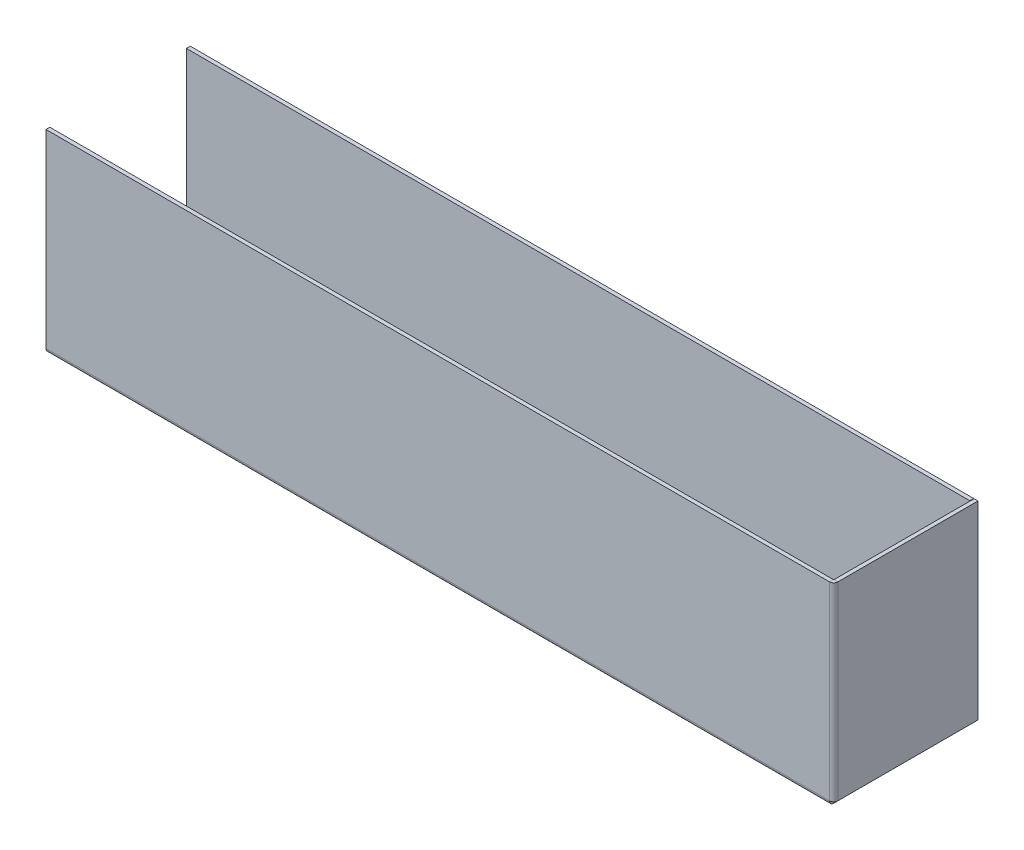
from build123d import *

# Parameters (mm, degrees)
SKETCH2_W             = 202
SKETCH2_H             = 13.5
BASE_FLANGE1_DEPTH    = 1
EDGE_FLANGE1_DEPTH    = 202
SWEPT_FLANGE2_DEPTH   = 202
SWEPT_FLANGE2_2_DEPTH = 202
EDGE_FLANGE2_DEPTH    = 202
EDGE_FLANGE3_DEPTH    = 48.9


# Read off the part's stored shape, not the designer's step: Swept Flange2
# Sheet-metal steps are written as plain solids
with BuildPart() as part:
    # Sketch2 → Base-Flange1 (new body)
    with BuildSketch(Plane(origin=(0, 0, 0), x_dir=(1, 0, 0), z_dir=(0, 1, 0))):
        with Locations((101, 6.75)):
            Rectangle(SKETCH2_W, SKETCH2_H)
    extrude(amount=-BASE_FLANGE1_DEPTH)

    # Edge-Flange1 section (across the edge) → Edge-Flange1 (add)
    with BuildSketch(Plane(origin=(202, 0, -13.6), x_dir=(0, 0, 1), z_dir=(-1, 0, 0))):
        with BuildLine():
            Line((-1, 0.1), (-1, 49))
            Line((-1, 49), (0, 49))
            Line((0, 49), (0, 0.1))
            ThreePointArc((0, 0.1), (0.029289322, 0.029289322), (0.1, 0))
            Line((0.1, 0), (0.1, -1))
            ThreePointArc((0.1, -1), (-0.677817459, -0.677817459), (-1, 0.1))
        make_face()
    extrude(amount=EDGE_FLANGE1_DEPTH)

    # Swept Flange2 outline → Swept Flange2 (cut)
    with BuildSketch(Plane.YZ):
        with BuildLine():
            ThreePointArc((-1, -0.266145802), (-0.991798775, -0.132073302), (-0.967317391, 0))
            Line((-0.967317391, 0), (-1, 0))
            Line((-1, 0), (-1, -0.266145802))
        make_face()
    extrude(amount=SWEPT_FLANGE2_DEPTH, mode=Mode.SUBTRACT)

    # Swept Flange2 2 outline → Swept Flange2 2 (add)
    with BuildSketch(Plane.YZ):
        with BuildLine():
            Line((0, 21.5), (-1, 21.5))
            Line((-1, 21.5), (-1, 8.266145802))
            ThreePointArc((-1, 8.266145802), (-0.970971133, 8.015106296), (-0.885416667, 7.777316595))
            ThreePointArc((-0.885416667, 7.777316595), (0, 4), (-0.885416667, 0.222683405))
            ThreePointArc((-0.885416667, 0.222683405), (-0.932388615, 0.113556382), (-0.967317391, 0))
            Line((-0.967317391, 0), (0, 0))
            Line((0, 0), (0, -0.266145802))
            ThreePointArc((0, -0.266145802), (0.002638988, -0.243324029), (0.010416667, -0.221706783))
            ThreePointArc((0.010416667, -0.221706783), (1, 4), (0.010416667, 8.221706783))
            ThreePointArc((0.010416667, 8.221706783), (0.002638988, 8.243324029), (0, 8.266145802))
            Line((0, 8.266145802), (0, 21.5))
        make_face()
    extrude(amount=SWEPT_FLANGE2_2_DEPTH)

    # Edge-Flange2 section (across the edge) → Edge-Flange2 (add)
    with BuildSketch(Plane(origin=(0, 0, 21.6), x_dir=(0, 0, -1), z_dir=(1, 0, 0))):
        with BuildLine():
            Line((-1, 0.1), (-1, 49))
            Line((-1, 49), (0, 49))
            Line((0, 49), (0, 0.1))
            ThreePointArc((0, 0.1), (0.029289322, 0.029289322), (0.1, 0))
            Line((0.1, 0), (0.1, -1))
            ThreePointArc((0.1, -1), (-0.677817459, -0.677817459), (-1, 0.1))
        make_face()
    extrude(amount=EDGE_FLANGE2_DEPTH)

    # Edge-Flange3 section (across the edge) → Edge-Flange3 (add)
    with BuildSketch(Plane(origin=(202.1, 49, 21.6), x_dir=(-1, 0, 0), z_dir=(0, -1, 0))):
        with BuildLine():
            Line((-1, 0.1), (-1, 36.2))
            Line((-1, 36.2), (0, 36.2))
            Line((0, 36.2), (0, 0.1))
            ThreePointArc((0, 0.1), (0.029289322, 0.029289322), (0.1, 0))
            Line((0.1, 0), (0.1, -1))
            ThreePointArc((0.1, -1), (-0.677817459, -0.677817459), (-1, 0.1))
        make_face()
    extrude(amount=EDGE_FLANGE3_DEPTH)


solid = part.part
